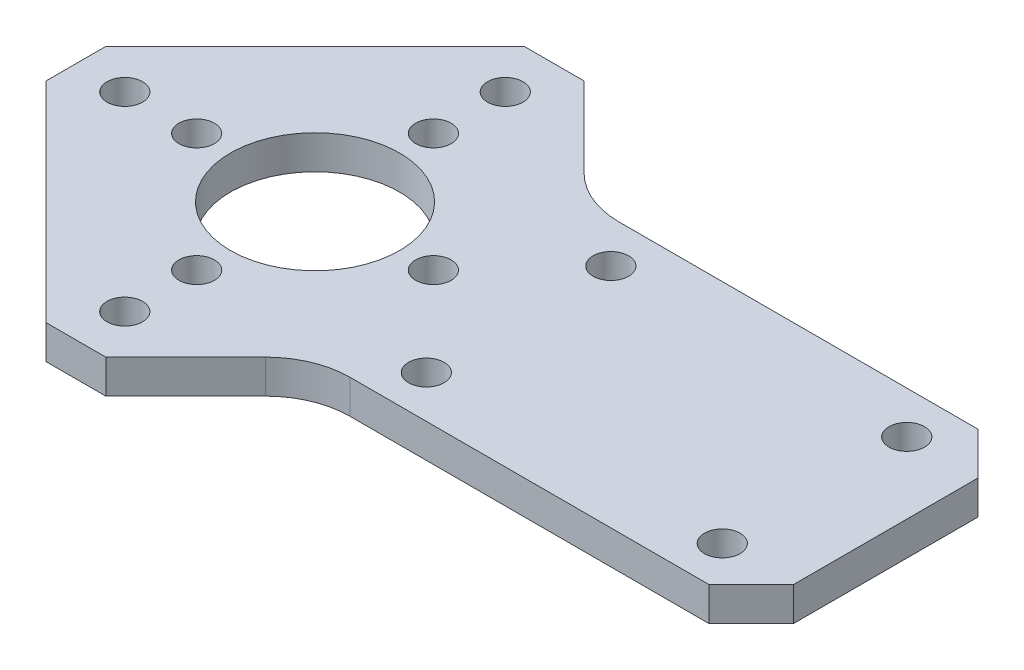
from build123d import *

# Parameters (mm, degrees)
SKETCH_1_R          = 2.1
SKETCH_1_R_2        = 10.5
SKETCH_1_R_3        = 10
EXTRUDE_1_DEPTH     = 4
CHAMFER_1_SIZE      = 5
FILLET_1_R          = 10
SKETCH_2_R          = 2.1
CUT_EXTRUDE_1_DEPTH = 10
EXTRUDE_START       = -3
SKETCH_3_R          = 1.6
EXTRUDE_2_DEPTH     = 3
FILLET_2_R          = 3
FILLET_3_R          = 11
SKETCH_4_R          = 1.6
EXTRUDE_3_DEPTH     = 3
FILLET_4_R          = 10
CHAMFER_2_SIZE      = 2
CHAMFER_2_SIZE2     = 1.851556395
FILLET_5_R          = 10
CUT_EXTRUDE_START   = -10
CUT_EXTRUDE_2_DEPTH = 10
CUT_EXTRUDE_3_DEPTH = 10
CHAMFER_3_SIZE      = 5


with BuildPart() as part:
    # 草图1 → 凸台-拉伸1 (new body)
    with BuildSketch(Plane(origin=(0, 0, 0), x_dir=(1, 0, 0), z_dir=(0, 1, 0))):
        Polygon((0, 31.819805153), (-31.819805153, 0), (0, -31.819805153), (15.909902577, -15.909902577), (67.5, -15.909902577), (67.5, -22.5), (112.5, -22.5), (112.5, 22.5), (67.5, 22.5), (67.5, 15.909902577), (15.909902577, 15.909902577), align=None)
        with Locations(Location((0, 14, 0), (0, 0, 270))):
            Circle(SKETCH_1_R, mode=Mode.SUBTRACT)
        with Locations(Location((14, 0, 0), (0, 0, 270))):
            Circle(SKETCH_1_R, mode=Mode.SUBTRACT)
        with Locations(Location((0, -14, 0), (0, 0, 270))):
            Circle(SKETCH_1_R, mode=Mode.SUBTRACT)
        with Locations(Location((-14, 0, 0), (0, 0, 270))):
            Circle(SKETCH_1_R, mode=Mode.SUBTRACT)
        with Locations(Location((90, 0, 0), (0, 0, 270))):
            Circle(SKETCH_1_R_2, mode=Mode.SUBTRACT)
        with Locations(Location((0, 22.5, 0), (0, 0, 270))):
            Circle(SKETCH_1_R, mode=Mode.SUBTRACT)
        with Locations(Location((0, -22.5, 0), (0, 0, 270))):
            Circle(SKETCH_1_R, mode=Mode.SUBTRACT)
        with Locations(Location((0, 0, 0), (0, 0, 270))):
            Circle(SKETCH_1_R_3, mode=Mode.SUBTRACT)
        with Locations(Location((-22.5, 0, 0), (0, 0, 270))):
            Circle(SKETCH_1_R, mode=Mode.SUBTRACT)
    extrude(amount=EXTRUDE_1_DEPTH)

    # 倒角1
    chamfer_1_edges = [part.edges().sort_by_distance(p)[0] for p in [
        (112.5, 2, -22.5),
        (112.5, 2, 22.5),
        (0, 2, 31.819805153),
        (-31.819805153, 2, 0),
        (0, 2, -31.819805153),
    ]]
    chamfer(chamfer_1_edges, length=CHAMFER_1_SIZE)

    # 圆角1
    # the kernel refuses this fillet: 10 mm, written as the material it adds along each edge
    with BuildSketch(Plane(origin=(15.909902577, 0, -15.909902577), x_dir=(-0.707106781186552, 0, -0.707106781186543), z_dir=(0, 1, 0))) as fillet_1_piece_1:
        with BuildLine():
            CenterArc((FILLET_1_R * 0.414213562373, -FILLET_1_R), FILLET_1_R, 90, 45)
            Line((-FILLET_1_R * 0.292893218813, -FILLET_1_R * 0.292893218813), (-FILLET_1_R * 0.307035354437, -FILLET_1_R * 0.27875108319))
            Line((-FILLET_1_R * 0.307035354437, -FILLET_1_R * 0.27875108319), (-FILLET_1_R * 0.00828427124746, FILLET_1_R * 0.02))
            Line((-FILLET_1_R * 0.00828427124746, FILLET_1_R * 0.02), (FILLET_1_R * 0.414213562373, FILLET_1_R * 0.02))
            Line((FILLET_1_R * 0.414213562373, FILLET_1_R * 0.02), (FILLET_1_R * 0.414213562373, 0))
        make_face()
    extrude(amount=4)
    with BuildSketch(Plane(origin=(15.909902577, 0, 15.909902577), x_dir=(-0.7071067811865422, 0, 0.707106781186553), z_dir=(0, 1, 0))) as fillet_1_piece_2:
        with BuildLine():
            CenterArc((FILLET_1_R * 0.414213562373, FILLET_1_R), FILLET_1_R, 225, 45)
            Line((-FILLET_1_R * 0.292893218813, FILLET_1_R * 0.292893218813), (-FILLET_1_R * 0.307035354437, FILLET_1_R * 0.27875108319))
            Line((-FILLET_1_R * 0.307035354437, FILLET_1_R * 0.27875108319), (-FILLET_1_R * 0.00828427124746, -FILLET_1_R * 0.02))
            Line((-FILLET_1_R * 0.00828427124746, -FILLET_1_R * 0.02), (FILLET_1_R * 0.414213562373, -FILLET_1_R * 0.02))
            Line((FILLET_1_R * 0.414213562373, -FILLET_1_R * 0.02), (FILLET_1_R * 0.414213562373, 0))
        make_face()
    extrude(amount=4)
    with BuildSketch(Plane(origin=(67.5, 0, 15.909902577), x_dir=(-1, 0, 0), z_dir=(0, 1, 0))) as fillet_1_piece_3:
        with BuildLine():
            CenterArc((9.400668296, 10), FILLET_1_R, 199.937217397, 70.062782603)
            Line((0, 6.590097423), (-0.188013366, 6.521899372))
            ThreePointArc((-0.188013366, 6.521899372), (-0.2, 3.295048712), (-0.2, 0))
            Line((-0.2, 0), (0, -0.2))
            Line((0, -0.2), (9.400668296, -0.2))
            Line((9.400668296, -0.2), (9.400668296, 0))
        make_face()
    extrude(amount=4)
    with BuildSketch(Plane(origin=(67.5, 0, -15.909902577), x_dir=(-1, 0, 0), z_dir=(0, 1, 0))) as fillet_1_piece_4:
        with BuildLine():
            CenterArc((9.400668296, -10), FILLET_1_R, 90, 70.062782603)
            Line((0, -6.590097423), (-0.188013366, -6.521899372))
            ThreePointArc((-0.188013366, -6.521899372), (-0.2, -3.295048712), (-0.2, 0))
            Line((-0.2, 0), (0, 0.2))
            Line((0, 0.2), (9.400668296, 0.2))
            Line((9.400668296, 0.2), (9.400668296, 0))
        make_face()
    extrude(amount=4)

    # 草图2 → 切除-拉伸1 (cut)
    with BuildSketch(Plane.XZ):
        with Locations(Location((106.464466094, 16.464466094, 0), (0, 0, 270))):
            Circle(SKETCH_2_R)
        with Locations(Location((106.464466094, -16.464466094, 0), (0, 0, 270))):
            Circle(SKETCH_2_R)
        with Locations(Location((73.535533906, -16.464466094, 0), (0, 0, 90))):
            Circle(SKETCH_2_R)
        with Locations(Location((73.535533906, 16.464466094, 0), (0, 0, 90))):
            Circle(SKETCH_2_R)
        with Locations(Location((24.075684952, 10.909902577, 0), (0, 0, 270))):
            Circle(SKETCH_2_R)
        with Locations(Location((59.075684952, 10.909902577, 0), (0, 0, 270))):
            Circle(SKETCH_2_R)
        with Locations(Location((59.075684952, -10.909902577, 0), (0, 0, 90))):
            Circle(SKETCH_2_R)
        with Locations(Location((24.075684952, -10.909902577, 0), (0, 0, 90))):
            Circle(SKETCH_2_R)
    extrude(amount=-CUT_EXTRUDE_1_DEPTH, mode=Mode.SUBTRACT)

    # 草图3 → 凸台-拉伸2 (add)
    with BuildSketch(Plane(origin=(0, 4, 0), x_dir=(1, 0, 0), z_dir=(0, 1, 0)).offset(EXTRUDE_START)):
        with BuildLine():
            Line((3.535533906, 28.284271247), (40.057636417, 81.344203773))
            ThreePointArc((40.057636417, 81.344203773), (45.94930127, 83.86671265), (50.75784592, 79.629654221))
            Line((50.75784592, 79.629654221), (67.5, 22.5))
            ThreePointArc((67.5, 22.5), (63.839583189, 17.721525883), (58.099331704, 15.909902577))
            Line((58.099331704, 15.909902577), (20.0520382, 15.909902577))
            ThreePointArc((20.0520382, 15.909902577), (16.225203877, 16.671107252), (12.980970389, 18.838834765))
            Line((12.980970389, 18.838834765), (3.535533906, 28.284271247))
        make_face()
        with Locations(Location((45, 77.942286341, 0), (0, 0, 270))):
            Circle(SKETCH_3_R, mode=Mode.SUBTRACT)
        Polygon((16.491758356, 29.470182421), (43.526560522, 68.746803428), (56.080145943, 25.909902577), (20.0520382, 25.909902577), align=None, mode=Mode.SUBTRACT)
    extrude(amount=EXTRUDE_2_DEPTH)

    # 圆角2
    fillet_2_edges = [part.edges().sort_by_distance(p)[0] for p in [
        (16.491758356, 2.5, -29.470182421),
        (43.526560522, 2.5, -68.746803428),
        (56.080145943, 2.5, -25.909902577),
        (20.0520382, 2.5, -25.909902577),
    ]]
    fillet(fillet_2_edges, radius=FILLET_2_R)

    # 圆角3
    fillet_3_edges = [part.edges().sort_by_distance(p)[0] for p in [
        (3.535533906, 2.5, -28.284271247),
        (67.5, 2.5, -22.5),
    ]]
    fillet(fillet_3_edges, radius=FILLET_3_R)

    # 草图4 → 凸台-拉伸3 (add)
    with BuildSketch(Plane(origin=(0, 4, 0), x_dir=(1, 0, 0), z_dir=(0, 1, 0)).offset(EXTRUDE_START)):
        with BuildLine():
            Line((45.94930127, 83.86671265), (81.347717681, 83.86671265))
            Line((81.347717681, 83.86671265), (107.5, 22.5))
            Line((107.5, 22.5), (97.716806526, 22.5))
            Line((97.716806526, 22.5), (75.4, 74.86671265))
            Line((75.4, 74.86671265), (52.153651701, 74.86671265))
            Line((52.153651701, 74.86671265), (50.75784592, 79.629654221))
            ThreePointArc((50.75784592, 79.629654221), (48.966689034, 82.443994695), (45.94930127, 83.86671265))
        make_face()
        with Locations(Location((78, 77.942286341, 0), (0, 0, 270))):
            Circle(SKETCH_4_R, mode=Mode.SUBTRACT)
    extrude(amount=EXTRUDE_3_DEPTH)

    # 圆角4
    fillet_4_edges = [part.edges().sort_by_distance(p)[0] for p in [
        (97.716806526, 2.5, -22.5),
        (75.4, 2.5, -74.86671265),
        (52.153651701, 2.5, -74.86671265),
    ]]
    fillet(fillet_4_edges, radius=FILLET_4_R)

    # 倒角2
    chamfer_2_edges = [part.edges().sort_by_distance(p)[0] for p in [
        (81.347717681, 2.5, -83.86671265),
    ]]
    chamfer_2_side = [part.faces().sort_by_distance(p)[0] for p in [
        (63.648509476, 2.5, -83.86671265),
    ]]
    chamfer(chamfer_2_edges, length=CHAMFER_2_SIZE, length2=CHAMFER_2_SIZE2, reference=chamfer_2_side[0])

    # 圆角5
    fillet_5_edges = [part.edges().sort_by_distance(p)[0] for p in [
        (107.5, 2.5, -22.5),
    ]]
    fillet(fillet_5_edges, radius=FILLET_5_R)

    # 草图5 → 切除-拉伸2 (cut)
    with BuildSketch(Plane(origin=(0, 4, 0), x_dir=(1, 0, 0), z_dir=(0, 1, 0)).offset(CUT_EXTRUDE_START)):
        with BuildLine():
            Line((67.5, -22.5), (67.5, -34.552858439))
            Line((67.5, -34.552858439), (139.474887753, -46.263885721))
            Line((139.474887753, -46.263885721), (130.519396302, 71.535271055))
            Line((130.519396302, 71.535271055), (50.264415224, 107.357236858))
            Line((50.264415224, 107.357236858), (-15.814227001, 52.524784707))
            Line((-15.814227001, 52.524784707), (-3.535533906, 28.284271247))
            Line((-3.535533906, 28.284271247), (3.535533906, 28.284271247))
            Line((3.535533906, 28.284271247), (12.980970389, 18.838834765))
            ThreePointArc((12.980970389, 18.838834765), (16.225203877, 16.671107252), (20.0520382, 15.909902577))
            Line((20.0520382, 15.909902577), (58.099331704, 15.909902577))
            ThreePointArc((58.099331704, 15.909902577), (63.839583189, 17.721525883), (67.5, 22.5))
            Line((67.5, 22.5), (67.5, -22.5))
        make_face()
    extrude(amount=CUT_EXTRUDE_2_DEPTH, mode=Mode.SUBTRACT)

    # 草图6 → 切除-拉伸3 (cut)
    with BuildSketch(Plane(origin=(0, 4, 0), x_dir=(1, 0, 0), z_dir=(0, 1, 0))):
        Polygon((58.099331704, 15.909902577), (80.044473587, 15.909902577), (76.388599313, 31.9888999), (52.293064323, 28.831553936), align=None)
        Polygon((58.099331704, -15.909902577), (78.21653645, -15.909902577), (69.071902646, -30.327138866), (59.799179703, -28.451958172), align=None)
    extrude(amount=-CUT_EXTRUDE_3_DEPTH, mode=Mode.SUBTRACT)

    # 倒角3
    chamfer_3_edges = [part.edges().sort_by_distance(p)[0] for p in [
        (67.5, 2, -15.909902577),
        (67.5, 2, 15.909902577),
    ]]
    chamfer(chamfer_3_edges, length=CHAMFER_3_SIZE)


solid = part.part
